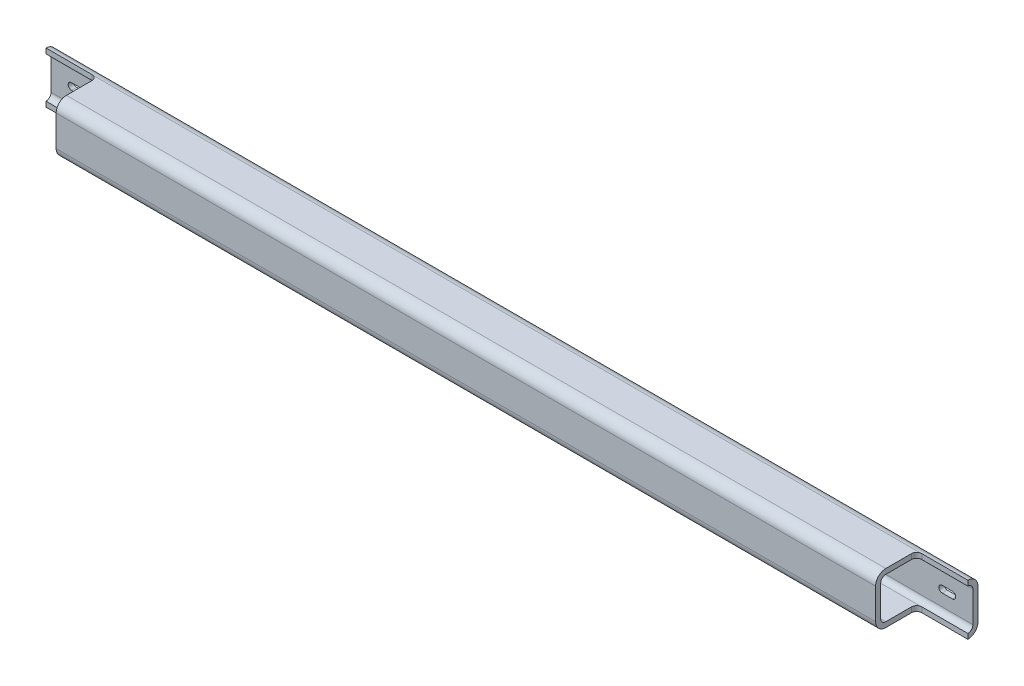
from build123d import *

# Parameters (mm, degrees)
SHS_RHS50X50X5_1_DEPTH  = 900
CUT_EXTRUDE1_DEPTH      = 452.386752132
CUT_EXTRUDE1_DEPTH_BACK = 452.386752132
SKETCH20_W              = 50
SKETCH20_H              = 40.1
FILLET1_START           = -25
FILLET1_DEPTH           = 5
FILLET1_START_2         = 20
FILLET1_2_DEPTH         = 5
CUT_EXTRUDE2_DEPTH      = 10


with BuildPart() as part:
    # Sketch116 → Shs RHS50X50X5(1) (new body)
    with BuildSketch(Plane.YZ.offset(-450)):
        with BuildLine():
            Line((-15, -25), (15, -25))
            ThreePointArc((15, -25), (22.071067812, -22.071067812), (25, -15))
            Line((25, -15), (25, 15))
            ThreePointArc((25, 15), (22.071067812, 22.071067812), (15, 25))
            Line((15, 25), (-15, 25))
            ThreePointArc((-15, 25), (-22.071067812, 22.071067812), (-25, 15))
            Line((-25, 15), (-25, -15))
            ThreePointArc((-25, -15), (-22.071067812, -22.071067812), (-15, -25))
        make_face()
        with BuildLine():
            Line((-15, -20), (15, -20))
            ThreePointArc((15, -20), (18.535533906, -18.535533906), (20, -15))
            Line((20, -15), (20, 15))
            ThreePointArc((20, 15), (18.535533906, 18.535533906), (15, 20))
            Line((15, 20), (-15, 20))
            ThreePointArc((-15, 20), (-18.535533906, 18.535533906), (-20, 15))
            Line((-20, 15), (-20, -15))
            ThreePointArc((-20, -15), (-18.535533906, -18.535533906), (-15, -20))
        make_face(mode=Mode.SUBTRACT)
    extrude(amount=SHS_RHS50X50X5_1_DEPTH)

    # Sketch20 → Cut-Extrude1 (cut, two sides: drawn at the far end of the back side and taken through both)
    with BuildSketch(Plane(origin=(0, 0, 0), x_dir=(1, 0, 0), z_dir=(0, 1, 0)).offset(-CUT_EXTRUDE1_DEPTH_BACK)):
        with Locations((425, -4.95)):
            Rectangle(SKETCH20_W, SKETCH20_H)
        with Locations((-425, -4.95)):
            Rectangle(SKETCH20_W, SKETCH20_H)
    extrude(amount=CUT_EXTRUDE1_DEPTH + CUT_EXTRUDE1_DEPTH_BACK, mode=Mode.SUBTRACT)

    # Fillet1: read off the stored shape, not the designer's step
    # Fillet1 outline → Fillet1 (add)
    with BuildSketch(Plane(origin=(0, 0, 0), x_dir=(1, 0, 0), z_dir=(0, 1, 0)).offset(FILLET1_START)):
        with BuildLine():
            Line((400, 15.1), (400, 10.1))
            ThreePointArc((400, 10.1), (401.464466094, 13.635533906), (405, 15.1))
            Line((405, 15.1), (400, 15.1))
        make_face()
        with BuildLine():
            Line((-400, 15.1), (-405, 15.1))
            ThreePointArc((-405, 15.1), (-401.464466094, 13.635533906), (-400, 10.1))
            Line((-400, 10.1), (-400, 15.1))
        make_face()
    extrude(amount=FILLET1_DEPTH)

    # Fillet1 2 outline → Fillet1 2 (add)
    with BuildSketch(Plane(origin=(0, 0, 0), x_dir=(1, 0, 0), z_dir=(0, 1, 0)).offset(FILLET1_START_2)):
        with BuildLine():
            Line((400, 15.1), (400, 10.1))
            ThreePointArc((400, 10.1), (401.464466094, 13.635533906), (405, 15.1))
            Line((405, 15.1), (400, 15.1))
        make_face()
        with BuildLine():
            Line((-400, 15.1), (-405, 15.1))
            ThreePointArc((-405, 15.1), (-401.464466094, 13.635533906), (-400, 10.1))
            Line((-400, 10.1), (-400, 15.1))
        make_face()
    extrude(amount=FILLET1_2_DEPTH)

    # Sketch21 → Cut-Extrude2 (cut)
    with BuildSketch(Plane(origin=(0, 0, -25), x_dir=(-1, 0, 0), z_dir=(0, 0, 1))):
        with BuildLine():
            Line((420, 3.25), (430, 3.25))
            ThreePointArc((430, 3.25), (433.25, 0), (430, -3.25))
            Line((430, -3.25), (420, -3.25))
            ThreePointArc((420, -3.25), (416.75, 0), (420, 3.25))
        make_face()
        with BuildLine():
            Line((-430, 3.25), (-420, 3.25))
            ThreePointArc((-420, 3.25), (-416.75, 0), (-420, -3.25))
            Line((-420, -3.25), (-430, -3.25))
            ThreePointArc((-430, -3.25), (-433.25, 0), (-430, 3.25))
        make_face()
    extrude(amount=CUT_EXTRUDE2_DEPTH, mode=Mode.SUBTRACT)


solid = part.part
